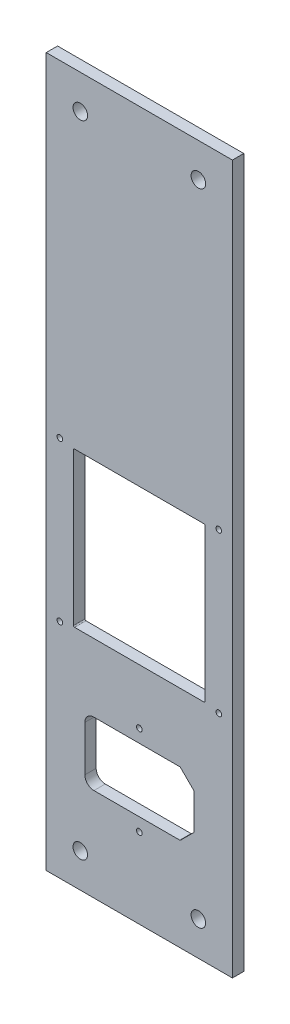
from build123d import *

# Parameters (mm, degrees)
SKETCH1_W                = 82
SKETCH1_H                = 312
BOSS_EXTRUDE1_DEPTH      = 5
SKETCH2_R                = 1.25
SKETCH2_W                = 48
SKETCH2_H                = 28
CUT_EXTRUDE1_DEPTH       = 10
CHAMFER1_SIZE            = 6
FILLET1_R                = 4
SKETCH3_W                = 58
SKETCH3_H                = 68
CUT_EXTRUDE2_DEPTH       = 162.375338884
M3X0_5_TAPPED_HOLE1_D    = 2.5
FILLET2_R                = 0.5
M6_CLEARANCE_HOLE1_D     = 6.4
M6_CLEARANCE_HOLE1_DEPTH = 5
M6_CLEARANCE_HOLE1_TIP   = 1.922753981


with BuildPart() as part:
    # Sketch1 → Boss-Extrude1 (new body)
    with BuildSketch(Plane.XY):
        Rectangle(SKETCH1_W, SKETCH1_H)
    extrude(amount=BOSS_EXTRUDE1_DEPTH)

    # Sketch2 → Cut-Extrude1 (cut)
    with BuildSketch(Plane.XY.offset(5)):
        with Locations((0, -81.25)):
            Circle(SKETCH2_R)
        with Locations((0, -120.75)):
            Circle(SKETCH2_R)
        with Locations((0, -101)):
            Rectangle(SKETCH2_W, SKETCH2_H)
    extrude(amount=-CUT_EXTRUDE1_DEPTH, mode=Mode.SUBTRACT)

    # Chamfer1
    chamfer1_edges = [part.edges().sort_by_distance(p)[0] for p in [
        (24, -115, 2.5),
        (24, -87, 2.5),
    ]]
    chamfer(chamfer1_edges, length=CHAMFER1_SIZE)

    # Fillet1
    fillet1_edges = [part.edges().sort_by_distance(p)[0] for p in [
        (-24, -115, 2.5),
        (-24, -87, 2.5),
    ]]
    fillet(fillet1_edges, radius=FILLET1_R)

    # Sketch3 → Cut-Extrude2 (cut, through all)
    with BuildSketch(Plane.XY.offset(5)):
        with Locations((0, -23)):
            Rectangle(SKETCH3_W, SKETCH3_H)
    extrude(amount=-CUT_EXTRUDE2_DEPTH, mode=Mode.SUBTRACT)

    # M3x0.5 Tapped Hole1 (through all)
    with Locations(Plane.XY.offset(5)):
        with Locations((-35, 12), (35, 12), (35, -58), (-35, -58)):
            Hole(M3X0_5_TAPPED_HOLE1_D / 2)

    # Fillet2
    fillet2_edges = [part.edges().sort_by_distance(p)[0] for p in [
        (18, -115, 2.5),
        (24, -109, 2.5),
        (24, -93, 2.5),
        (18, -87, 2.5),
        (29, -57, 2.5),
        (-29, -57, 2.5),
        (-29, 11, 2.5),
        (29, 11, 2.5),
    ]]
    fillet(fillet2_edges, radius=FILLET2_R)

    # M6 Clearance Hole1
    with Locations(Plane.XY.offset(5)):
        with Locations((-26, 141), (26, 141), (-26, -141), (26, -141)):
            Hole(M6_CLEARANCE_HOLE1_D / 2, depth=M6_CLEARANCE_HOLE1_DEPTH)
            with Locations((0, 0, -(M6_CLEARANCE_HOLE1_DEPTH + M6_CLEARANCE_HOLE1_TIP / 2))):  # 118° drill point
                Cone(0, M6_CLEARANCE_HOLE1_D / 2, M6_CLEARANCE_HOLE1_TIP, mode=Mode.SUBTRACT)


solid = part.part
